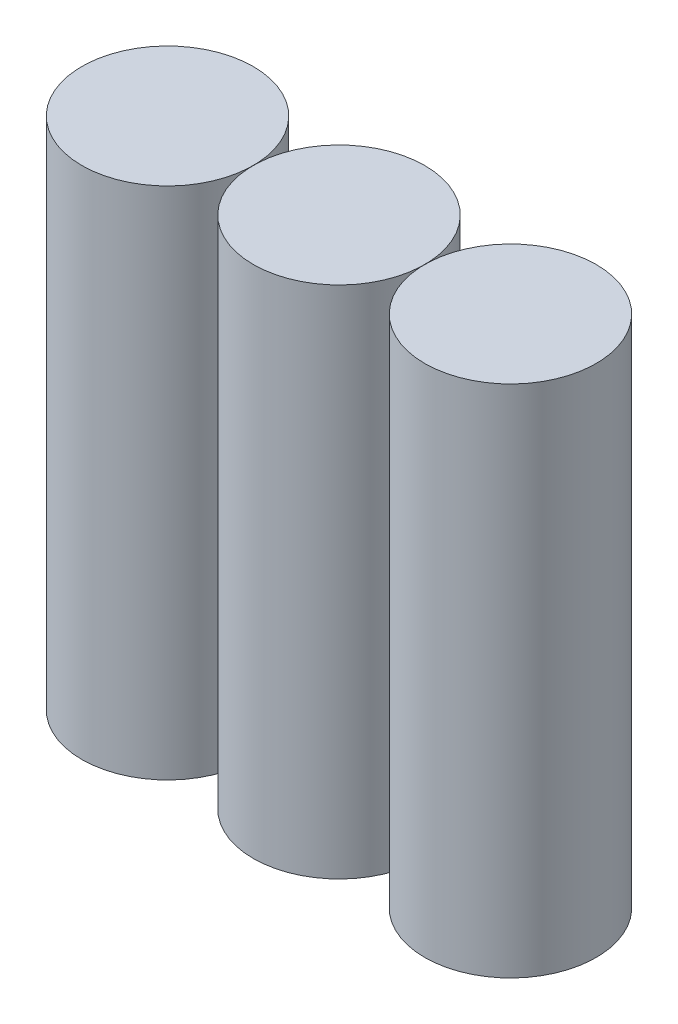
from build123d import *

# Parameters (mm, degrees)
SKETCH1_R             = 2.5
BOSS_EXTRUDE1_DEPTH   = 15
BOSS_EXTRUDE1_2_DEPTH = 15
BOSS_EXTRUDE1_3_DEPTH = 15


with BuildPart() as part:
    # Sketch1 → Boss-Extrude1 (new body)
    with BuildSketch(Plane(origin=(0, 0, 0), x_dir=(1, 0, 0), z_dir=(0, 1, 0))):
        with Locations((5, 0)):
            Circle(SKETCH1_R)
    extrude(amount=BOSS_EXTRUDE1_DEPTH)


with BuildPart() as body_2:
    # Sketch1 → Boss-Extrude1 2 (new body)
    with BuildSketch(Plane(origin=(0, 0, 0), x_dir=(1, 0, 0), z_dir=(0, 1, 0))):
        with BuildLine():
            ThreePointArc((-2.5, 0), (0, -2.5), (2.5, 0))
            ThreePointArc((2.5, 0), (0, 2.5), (-2.5, 0))
        make_face()
    extrude(amount=BOSS_EXTRUDE1_2_DEPTH)


with BuildPart() as body_3:
    # Sketch1 → Boss-Extrude1 3 (new body)
    with BuildSketch(Plane(origin=(0, 0, 0), x_dir=(1, 0, 0), z_dir=(0, 1, 0))):
        with Locations((-5, 0)):
            Circle(SKETCH1_R)
    extrude(amount=BOSS_EXTRUDE1_3_DEPTH)


solid = Compound([part.part, body_2.part, body_3.part])
